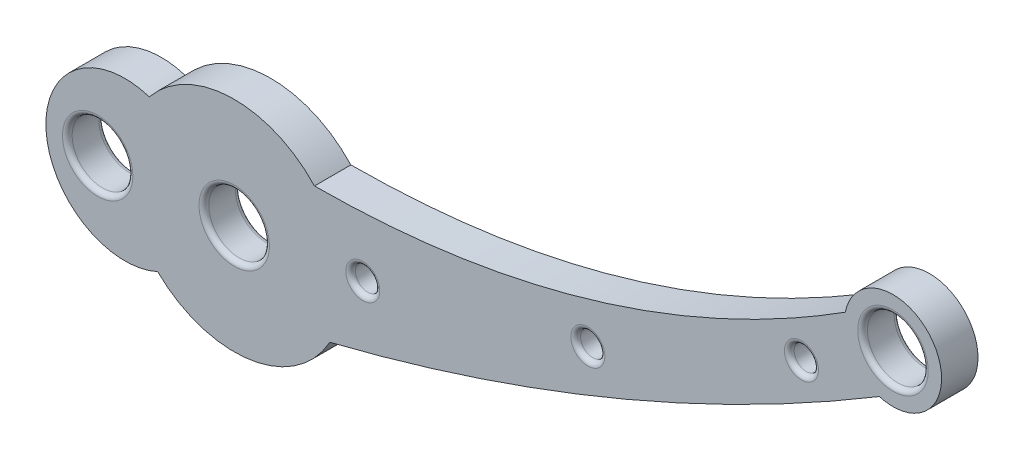
from build123d import *

# Parameters (mm, degrees)
SKETCH1_R               = 5
BOSS_EXTRUDE1_DEPTH     = 3
SHELL1_START            = -3
SHELL1_OUTLINE_R        = 9
SHELL1_DEPTH            = 2
BOSS_EXTRUDE2_START     = -2
SKETCH2_R               = 17.523356528
SKETCH2_R_2             = 14.0203
BOSS_EXTRUDE2_DEPTH     = 2
CUT_EXTRUDE1_START      = -3
SKETCH3_R               = 4.4
SKETCH3_R_2             = 2
CUT_EXTRUDE1_DEPTH      = 2
CUT_EXTRUDE2_DEPTH      = 125.685100358
CUT_EXTRUDE2_DEPTH_BACK = 125.685100358
FILLET1_R               = 0.8


# Read off the part's stored shape, not the designer's step: Shell1
with BuildPart() as part:
    # Sketch1 → Boss-Extrude1 (new, symmetric)
    with BuildSketch(Plane.XY):
        with BuildLine():
            ThreePointArc((-13.986661418, 11.362416753), (-30.99016616, -1.768742422), (-12.603041823, -12.88000578))
            ThreePointArc((-12.603041823, -12.88000578), (2.589578584, -17.833263718), (15.7458991, -8.7634396))
            add(Edge.make_bspline(
                [(15.7458991, -8.7634396), (63.871433409, 3.240310882), (106.224960773, 28.730122074)],
                knots=[0, 0, 0, 0.937425, 0.937425, 0.937425], degree=2))
            ThreePointArc((106.224960773, 28.730122074), (115.307763597, 40.561261508), (100.621270103, 37.95740354))
            add(Edge.make_bspline(
                [(100.621270103, 37.95740354), (60.4120667, 12.413572858), (13.212454281, 12.254071322)],
                knots=[1.049785924, 1.049785924, 1.049785924, 1.987896241, 1.987896241, 1.987896241], degree=2))
            ThreePointArc((13.212454281, 12.254071322), (-0.59043301, 18.010624669), (-13.986661418, 11.362416753))
        make_face()
        with Locations((-22.486761251, -1.283416434)):
            Circle(SKETCH1_R, mode=Mode.SUBTRACT)
        Circle(SKETCH1_R, mode=Mode.SUBTRACT)
        with Locations((108.469927907, 36.408671583)):
            Circle(SKETCH1_R, mode=Mode.SUBTRACT)
    extrude(amount=BOSS_EXTRUDE1_DEPTH, both=True)

    # Shell1 outline → Shell1 (cut)
    with BuildSketch(Plane.XY.offset(SHELL1_START)):
        with BuildLine():
            ThreePointArc((-11.793799998, -7.581232992), (1.267131363, -13.962921979), (12.965880978, -5.334298694))
            add(Edge.make_bspline(
                [(12.965880978, -5.334298694), (13.091467509, -5.302974172), (13.21705404, -5.271649649), (13.342640571, -5.240325127), (13.468227101, -5.209000604), (13.593813632, -5.177676082), (13.719400163, -5.14635156), (13.844986694, -5.115027037), (13.970573225, -5.083702515), (14.096159756, -5.052377992), (14.221746287, -5.02105347), (14.347332818, -4.989728947), (14.472919349, -4.958404425), (14.606355038, -4.92512212), (14.614204196, -4.923164337), (14.622053354, -4.921206554), (14.629902512, -4.919248772), (14.637751671, -4.917290989), (14.645600829, -4.915333206), (14.653449987, -4.913375424), (14.661299145, -4.911417641), (14.669148303, -4.909459858), (14.676997462, -4.907502076), (14.68484662, -4.905544293), (14.692695778, -4.90358651), (14.704469515, -4.900649836), (14.708394094, -4.899670945), (14.712318673, -4.898692054), (14.716243252, -4.897713162), (14.720167832, -4.896734271), (14.724092411, -4.89575538), (14.72801699, -4.894776488), (14.731941569, -4.893797597), (14.735866148, -4.892818706), (14.739790727, -4.891839814), (14.743715306, -4.890860923), (14.747639885, -4.889882032), (14.753526754, -4.888413695), (14.755489043, -4.887924249), (14.757451333, -4.887434803), (14.759413622, -4.886945358), (14.761375912, -4.886455912), (14.763338202, -4.885966466), (14.765300491, -4.885477021), (14.767262781, -4.884987575), (14.76922507, -4.884498129), (14.77118736, -4.884008684), (14.773149649, -4.883519238), (14.775111939, -4.883029792), (14.778055373, -4.882295624), (14.779063903, -4.882044071), (14.779844692, -4.881849326), (14.781264137, -4.881495242), (14.781497944, -4.881436973), (14.783358504, -4.880972806), (14.783510742, -4.880934899), (14.78504843, -4.880551277), (14.785724208, -4.88038273), (14.786802115, -4.880113832), (14.787745771, -4.879878432), (14.788718457, -4.879635785), (14.790657615, -4.879152034), (14.791627192, -4.878910155), (14.792596769, -4.878668274), (14.793566344, -4.87842639), (14.794535917, -4.878184502), (14.795505489, -4.877942612), (14.79647506, -4.877700719), (14.79744463, -4.877458822), (14.798414199, -4.877216923), (14.799383766, -4.87697502), (14.800353331, -4.876733115), (14.801322896, -4.876491207), (14.81780547, -4.872378714), (14.833318148, -4.868507365), (14.848830492, -4.86463525), (14.864342503, -4.860762367), (14.87985418, -4.856888718), (14.895365524, -4.853014302), (14.910876535, -4.849139118), (14.926387213, -4.845263168), (14.941897557, -4.841386451), (14.957407567, -4.837508966), (14.972917245, -4.833630715), (14.988426589, -4.829751697), (15.034953621, -4.818112341), (15.065970309, -4.810349703), (15.096985663, -4.802583997), (15.127999684, -4.794815223), (15.159012372, -4.787043382), (15.190023727, -4.779268472), (15.221033748, -4.771490494), (15.252042436, -4.763709449), (15.28304979, -4.755925336), (15.314055811, -4.748138155), (15.345060499, -4.740347906), (15.376063854, -4.732554589), (15.469069919, -4.709165435), (15.531068628, -4.693560394), (15.593062006, -4.677943082), (15.65505005, -4.662313499), (15.717032761, -4.646671644), (15.779010141, -4.631017517), (15.840982187, -4.61535112), (15.902948901, -4.599672451), (15.964910283, -4.58398151), (16.026866333, -4.568278298), (16.088817051, -4.552562815), (16.150762437, -4.536835061), (16.460462707, -4.458134932), (16.708137614, -4.394978487), (16.955727219, -4.331625702), (17.203231528, -4.268076576), (17.450650548, -4.20433111), (17.697984287, -4.140389305), (17.945232751, -4.07625116), (18.192395947, -4.011916676), (18.439473881, -3.947385854), (18.686466561, -3.882658694), (18.933373994, -3.817735196), (19.180196186, -3.75261536), (19.92040706, -3.556666841), (20.41354004, -3.42524915), (20.906332139, -3.293046113), (21.398783414, -3.160057731), (21.89089392, -3.026284004), (22.382663713, -2.891724933), (22.874092847, -2.756380518), (23.365181379, -2.62025076), (23.855929364, -2.483335658), (24.346336858, -2.345635214), (24.836403916, -2.207149428), (25.326130594, -2.0678783), (26.794289656, -1.647708893), (27.771701062, -1.364454628), (28.747751619, -1.078058999), (29.722441779, -0.788521966), (30.695771995, -0.49584349), (31.66774272, -0.200023534), (32.638354406, 0.098937942), (33.607607504, 0.401040976), (34.575502469, 0.706285607), (35.542039752, 1.014671875), (36.507219806, 1.326199816), (37.471043084, 1.640869471), (40.358443943, 2.594303692), (42.27795254, 3.242493717), (44.192039502, 3.903251495), (46.100708485, 4.57657766), (48.003963131, 5.262472933), (49.901807066, 5.960938126), (51.794243896, 6.671974141), (53.681277215, 7.395581971), (55.562910597, 8.131762697), (57.439147603, 8.880517491), (59.309991774, 9.641847614), (61.175446638, 10.415754419), (66.087097418, 12.492526394), (69.124183218, 13.816667273), (72.146788492, 15.174668269), (75.154928348, 16.566536317), (78.148617578, 17.992278966), (81.127870628, 19.451904349), (84.092701563, 20.945421144), (87.043124035, 22.472838546), (89.979151248, 24.034166231), (92.900795926, 25.629414321), (95.80807028, 27.258593353), (98.700985974, 28.921714246), (101.579554091, 30.618788264)],
                knots=[-0.017647481, -0.017647481, -0.017647481, -0.017647481, -0.017647481, -0.017647481, -0.017647481, -0.017647481, -0.017647481, -0.017647481, -0.017647481, -0.017647481, -0.017647481, -0.017647481, -0.001746739, -0.001746739, -0.001746739, -0.001746739, -0.001746739, -0.001746739, -0.001746739, -0.001746739, -0.001746739, -0.001746739, -0.001746739, -0.001746739, -0.000752943, -0.000752943, -0.000752943, -0.000752943, -0.000752943, -0.000752943, -0.000752943, -0.000752943, -0.000752943, -0.000752943, -0.000752943, -0.000752943, -0.000256045, -0.000256045, -0.000256045, -0.000256045, -0.000256045, -0.000256045, -0.000256045, -0.000256045, -0.000256045, -0.000256045, -0.000256045, -0.000256045, -7.596e-06, -7.596e-06, -7.596e-06, -7.596e-06, -7.596e-06, -7.596e-06, -7.596e-06, -7.596e-06, -7.596e-06, -7.596e-06, -7.596e-06, -7.596e-06, 0.000116629, 0.000116629, 0.000116629, 0.000116629, 0.000116629, 0.000116629, 0.000116629, 0.000116629, 0.000116629, 0.000116629, 0.000116629, 0.000116629, 0.000240853, 0.000240853, 0.000240853, 0.000240853, 0.000240853, 0.000240853, 0.000240853, 0.000240853, 0.000240853, 0.000240853, 0.000240853, 0.000240853, 0.002228446, 0.002228446, 0.002228446, 0.002228446, 0.002228446, 0.002228446, 0.002228446, 0.002228446, 0.002228446, 0.002228446, 0.002228446, 0.002228446, 0.006203632, 0.006203632, 0.006203632, 0.006203632, 0.006203632, 0.006203632, 0.006203632, 0.006203632, 0.006203632, 0.006203632, 0.006203632, 0.006203632, 0.014154002, 0.014154002, 0.014154002, 0.014154002, 0.014154002, 0.014154002, 0.014154002, 0.014154002, 0.014154002, 0.014154002, 0.014154002, 0.014154002, 0.045955486, 0.045955486, 0.045955486, 0.045955486, 0.045955486, 0.045955486, 0.045955486, 0.045955486, 0.045955486, 0.045955486, 0.045955486, 0.045955486, 0.109558454, 0.109558454, 0.109558454, 0.109558454, 0.109558454, 0.109558454, 0.109558454, 0.109558454, 0.109558454, 0.109558454, 0.109558454, 0.109558454, 0.236764389, 0.236764389, 0.236764389, 0.236764389, 0.236764389, 0.236764389, 0.236764389, 0.236764389, 0.236764389, 0.236764389, 0.236764389, 0.236764389, 0.491176259, 0.491176259, 0.491176259, 0.491176259, 0.491176259, 0.491176259, 0.491176259, 0.491176259, 0.491176259, 0.491176259, 0.491176259, 0.491176259, 0.908557864, 0.908557864, 0.908557864, 0.908557864, 0.908557864, 0.908557864, 0.908557864, 0.908557864, 0.908557864, 0.908557864, 0.908557864, 0.908557864, 0.908557864, 0.908557864], degree=13))
            ThreePointArc((101.579554091, 30.618788264), (100.779952373, 31.732746403), (100.158859236, 32.955247552))
            add(Edge.make_bspline(
                [(11.337726348, 8.247713219), (11.460941784, 8.248129601), (11.584157221, 8.248545982), (11.707372657, 8.248962364), (11.830588093, 8.249378745), (11.953803529, 8.249795127), (12.077018965, 8.250211509), (12.200234402, 8.25062789), (12.323449838, 8.251044272), (12.446665274, 8.251460654), (12.56988071, 8.251877035), (12.693096146, 8.252293417), (12.816311583, 8.252709798), (12.954928948, 8.253178228), (12.970330878, 8.253230275), (12.985732807, 8.253282323), (13.001134737, 8.253334371), (13.016536666, 8.253386418), (13.031938596, 8.253438466), (13.047340525, 8.253490514), (13.062742455, 8.253542562), (13.078144384, 8.253594609), (13.093546314, 8.253646657), (13.108948243, 8.253698705), (13.124350173, 8.253750752), (13.143602585, 8.253815812), (13.147453067, 8.253828824), (13.15130355, 8.253841836), (13.155154032, 8.253854848), (13.159004514, 8.25386786), (13.162854997, 8.253880872), (13.166705479, 8.253893884), (13.170555962, 8.253906896), (13.174406444, 8.253919907), (13.178256926, 8.253932919), (13.182107409, 8.253945931), (13.185957891, 8.253958943), (13.191733615, 8.253978461), (13.193658856, 8.253984967), (13.195584097, 8.253991473), (13.197509338, 8.253997979), (13.199434579, 8.254004485), (13.201359821, 8.254010991), (13.203285062, 8.254017497), (13.205210303, 8.254024003), (13.207135544, 8.254030509), (13.209060785, 8.254037015), (13.210986027, 8.254043521), (13.212911268, 8.254050027), (13.215317819, 8.254058159), (13.21579913, 8.254059786), (13.21628044, 8.254061412), (13.21676175, 8.254063039), (13.21724306, 8.254064665), (13.217724371, 8.254066292), (13.218205681, 8.254067918), (13.218686991, 8.254069545), (13.219168302, 8.254071171), (13.219649612, 8.254072798), (13.220130922, 8.254074424), (13.220612233, 8.254076051), (13.221334198, 8.25407849), (13.221574853, 8.254079304), (13.221815508, 8.254080117), (13.222056163, 8.25408093), (13.222296818, 8.254081743), (13.222537474, 8.254082557), (13.222778129, 8.25408337), (13.223018784, 8.254084183), (13.223259439, 8.254084996), (13.223500094, 8.25408581), (13.223740749, 8.254086623), (13.223981405, 8.254087436), (13.224462715, 8.254089063), (13.224709046, 8.254089895), (13.224901329, 8.254090544), (13.225345475, 8.254092049), (13.22504416, 8.254091022), (13.226271591, 8.25409518), (13.225264809, 8.254091773), (13.226575551, 8.254096198), (13.226216174, 8.254094991), (13.226691195, 8.254096593), (13.226883582, 8.254097246), (13.22713589, 8.2540981), (13.228366609, 8.254102268), (13.229351183, 8.254105609), (13.230335756, 8.254108956), (13.231320327, 8.254112308), (13.232304896, 8.254115666), (13.233289464, 8.254119031), (13.23427403, 8.2541224), (13.235258596, 8.254125777), (13.236243159, 8.254129158), (13.237227721, 8.254132546), (13.238212281, 8.254135939), (13.23919684, 8.254139338), (13.248057857, 8.254169984), (13.25593422, 8.2541976), (13.263810487, 8.25422559), (13.271686657, 8.254253954), (13.279562732, 8.254282692), (13.28743871, 8.254311805), (13.295314591, 8.254341292), (13.303190377, 8.254371154), (13.311066066, 8.25440139), (13.318941659, 8.254432001), (13.326817155, 8.254462986), (13.334692555, 8.254494345), (13.374069075, 8.254653014), (13.40556875, 8.254785939), (13.437066884, 8.254924856), (13.468563477, 8.255069762), (13.500058529, 8.25522066), (13.53155204, 8.255377547), (13.56304401, 8.255540426), (13.594534439, 8.255709296), (13.626023327, 8.255884156), (13.657510673, 8.256065007), (13.688996478, 8.256251849), (13.720480741, 8.256444682), (13.814928906, 8.257041154), (13.877888184, 8.257462766), (13.940841294, 8.257908342), (14.003788238, 8.258377883), (14.066729013, 8.258871389), (14.12966362, 8.25938886), (14.192592058, 8.259930297), (14.255514326, 8.2604957), (14.318430424, 8.261085069), (14.381340351, 8.261698406), (14.444244107, 8.262335709), (14.50714169, 8.26299698), (14.821598746, 8.266423173), (15.073065632, 8.269547615), (15.32443372, 8.273055565), (15.575702972, 8.276947046), (15.826873349, 8.281222077), (16.077944813, 8.285880681), (16.328917326, 8.29092288), (16.579790848, 8.296348694), (16.830565342, 8.302158146), (17.081240767, 8.308351256), (17.331817087, 8.314928046), (17.582294262, 8.321888537), (18.333428239, 8.343921181), (18.833787513, 8.360144526), (19.333749743, 8.377902934), (19.833314593, 8.397196554), (20.332481728, 8.418025531), (20.831250814, 8.440390015), (21.329621514, 8.464290153), (21.827593495, 8.489726092), (22.325166421, 8.516697979), (22.822339956, 8.545205963), (23.319113767, 8.575250191), (23.815487517, 8.606830811), (25.303407582, 8.706182286), (26.293752609, 8.778562617), (27.28249312, 8.857090017), (28.269626243, 8.941765472), (29.255149064, 9.032589901), (30.239058632, 9.129564155), (31.221351956, 9.232689017), (32.202026006, 9.341965202), (33.181077713, 9.457393357), (34.158503966, 9.578974062), (35.134301617, 9.706707827), (36.108467479, 9.840595096), (39.026060015, 10.260718541), (40.964581718, 10.56541625), (42.896537822, 10.894732355), (44.821902267, 11.248668567), (46.740648653, 11.627225329), (48.652750347, 12.030401815), (50.558180593, 12.458195936), (52.456912621, 12.910604345), (54.348919753, 13.387622437), (56.234175513, 13.889244353), (58.112653735, 14.415462984), (59.984328673, 14.966269973), (64.90848085, 16.485583806), (67.949409127, 17.495660221), (70.971848636, 18.571843503), (73.975691746, 19.714083217), (76.960835801, 20.922320885), (79.927184257, 22.196490944), (82.8746476, 23.536521713), (85.803144091, 24.942336373), (88.712600307, 26.413853977), (91.60295149, 27.950990459), (94.474141708, 29.553659674), (97.326123816, 31.221774448), (100.158859236, 32.955247552)],
                knots=[-0.018764796, -0.018764796, -0.018764796, -0.018764796, -0.018764796, -0.018764796, -0.018764796, -0.018764796, -0.018764796, -0.018764796, -0.018764796, -0.018764796, -0.018764796, -0.018764796, -0.002846596, -0.002846596, -0.002846596, -0.002846596, -0.002846596, -0.002846596, -0.002846596, -0.002846596, -0.002846596, -0.002846596, -0.002846596, -0.002846596, -0.000856821, -0.000856821, -0.000856821, -0.000856821, -0.000856821, -0.000856821, -0.000856821, -0.000856821, -0.000856821, -0.000856821, -0.000856821, -0.000856821, -0.000359377, -0.000359377, -0.000359377, -0.000359377, -0.000359377, -0.000359377, -0.000359377, -0.000359377, -0.000359377, -0.000359377, -0.000359377, -0.000359377, -0.000110655, -0.000110655, -0.000110655, -0.000110655, -0.000110655, -0.000110655, -0.000110655, -0.000110655, -0.000110655, -0.000110655, -0.000110655, -0.000110655, -4.8475e-05, -4.8475e-05, -4.8475e-05, -4.8475e-05, -4.8475e-05, -4.8475e-05, -4.8475e-05, -4.8475e-05, -4.8475e-05, -4.8475e-05, -4.8475e-05, -4.8475e-05, -1.7384e-05, -1.7384e-05, -1.7384e-05, -1.7384e-05, -1.7384e-05, -1.7384e-05, -1.7384e-05, -1.7384e-05, -1.7384e-05, -1.7384e-05, -1.7384e-05, -1.7384e-05, 1.3706e-05, 1.3706e-05, 1.3706e-05, 1.3706e-05, 1.3706e-05, 1.3706e-05, 1.3706e-05, 1.3706e-05, 1.3706e-05, 1.3706e-05, 1.3706e-05, 1.3706e-05, 0.000138067, 0.000138067, 0.000138067, 0.000138067, 0.000138067, 0.000138067, 0.000138067, 0.000138067, 0.000138067, 0.000138067, 0.000138067, 0.000138067, 0.001132954, 0.001132954, 0.001132954, 0.001132954, 0.001132954, 0.001132954, 0.001132954, 0.001132954, 0.001132954, 0.001132954, 0.001132954, 0.001132954, 0.005112504, 0.005112504, 0.005112504, 0.005112504, 0.005112504, 0.005112504, 0.005112504, 0.005112504, 0.005112504, 0.005112504, 0.005112504, 0.005112504, 0.013071604, 0.013071604, 0.013071604, 0.013071604, 0.013071604, 0.013071604, 0.013071604, 0.013071604, 0.013071604, 0.013071604, 0.013071604, 0.013071604, 0.044908004, 0.044908004, 0.044908004, 0.044908004, 0.044908004, 0.044908004, 0.044908004, 0.044908004, 0.044908004, 0.044908004, 0.044908004, 0.044908004, 0.108580804, 0.108580804, 0.108580804, 0.108580804, 0.108580804, 0.108580804, 0.108580804, 0.108580804, 0.108580804, 0.108580804, 0.108580804, 0.108580804, 0.235926403, 0.235926403, 0.235926403, 0.235926403, 0.235926403, 0.235926403, 0.235926403, 0.235926403, 0.235926403, 0.235926403, 0.235926403, 0.235926403, 0.490617602, 0.490617602, 0.490617602, 0.490617602, 0.490617602, 0.490617602, 0.490617602, 0.490617602, 0.490617602, 0.490617602, 0.490617602, 0.490617602, 0.908441951, 0.908441951, 0.908441951, 0.908441951, 0.908441951, 0.908441951, 0.908441951, 0.908441951, 0.908441951, 0.908441951, 0.908441951, 0.908441951, 0.908441951, 0.908441951], degree=13))
            ThreePointArc((11.337726348, 8.247713219), (-1.201705579, 13.968704872), (-12.579790903, 6.190127053))
            ThreePointArc((-12.579790903, 6.190127053), (-16.51195231, 7.871386314), (-20.776562793, 7.55260197))
            ThreePointArc((-20.776562793, 7.55260197), (-13.501384182, -0.770582217), (-19.78232402, -9.867472542))
            ThreePointArc((-19.78232402, -9.867472542), (-15.509136424, -9.698967933), (-11.793799998, -7.581232992))
        make_face()
        Circle(SHELL1_OUTLINE_R, mode=Mode.SUBTRACT)
    extrude(amount=SHELL1_DEPTH, mode=Mode.SUBTRACT)

    # Sketch2 → Boss-Extrude2 (add)
    with BuildSketch(Plane.XY.offset(-1).offset(BOSS_EXTRUDE2_START)):
        Circle(SKETCH2_R)
        Circle(SKETCH2_R_2, mode=Mode.SUBTRACT)
    extrude(amount=BOSS_EXTRUDE2_DEPTH)

    # Sketch3 → Cut-Extrude1 (cut)
    # profile 1 of 3: a face of its own
    with BuildSketch(Plane.XY.offset(CUT_EXTRUDE1_START)):
        with Locations((93.400085506, 27.483303488)):
            Circle(SKETCH3_R)
        with Locations((93.400085506, 27.483303488)):
            Circle(SKETCH3_R_2, mode=Mode.SUBTRACT)
    # profile 2 of 3: a face of its own
    with BuildSketch(Plane.XY.offset(CUT_EXTRUDE1_START)):
        with Locations((58.228171872, 11.880638788)):
            Circle(SKETCH3_R)
    # profile 3 of 3: a face of its own
    with BuildSketch(Plane.XY.offset(CUT_EXTRUDE1_START)):
        with Locations((21.16652838, 2.687087966)):
            Circle(SKETCH3_R)
    extrude(amount=CUT_EXTRUDE1_DEPTH, mode=Mode.SUBTRACT)

    # Sketch3<3> → Cut-Extrude2 (cut, two sides: drawn at the far end of the back side and taken through both)
    with BuildSketch(Plane.XY.offset(-CUT_EXTRUDE2_DEPTH_BACK)):
        with BuildLine():
            ThreePointArc((19.190011126, 2.381507296), (21.319769191, 0.692967294), (23.16652838, 2.687087966))
            ThreePointArc((23.16652838, 2.687087966), (23.159961153, 2.849031715), (23.140302602, 3.009911943))
            add(Edge.make_bspline(
                [(19.190011126, 2.381507296), (21.170999041, 2.678959307), (23.140302602, 3.009911943)],
                knots=[0.020133275, 0.020133275, 0.020133275, 0.064624746, 0.064624746, 0.064624746], degree=2))
        make_face()
        with BuildLine():
            add(Edge.make_bspline(
                [(19.190011126, 2.381507296), (21.170999041, 2.678959307), (23.140302602, 3.009911943)],
                knots=[0.020133275, 0.020133275, 0.020133275, 0.064624746, 0.064624746, 0.064624746], degree=2))
            ThreePointArc((23.140302602, 3.009911943), (20.852323063, 4.662252521), (19.190011126, 2.381507296))
        make_face()
        with BuildLine():
            add(Edge.make_bspline(
                [(56.333093629, 11.241359153), (58.23123625, 11.872010174), (60.117317487, 12.537242814)],
                knots=[0.449453257, 0.449453257, 0.449453257, 0.494656852, 0.494656852, 0.494656852], degree=2))
            ThreePointArc((56.333093629, 11.241359153), (58.552088153, 9.90704353), (60.228171872, 11.880638788))
            ThreePointArc((60.228171872, 11.880638788), (60.200263558, 12.21358681), (60.117317487, 12.537242814))
        make_face()
        with BuildLine():
            ThreePointArc((60.117317487, 12.537242814), (57.580223252, 13.772770545), (56.333093629, 11.241359153))
            add(Edge.make_bspline(
                [(56.333093629, 11.241359153), (58.23123625, 11.872010174), (60.117317487, 12.537242814)],
                knots=[0.449453257, 0.449453257, 0.449453257, 0.494656852, 0.494656852, 0.494656852], degree=2))
        make_face()
        with BuildLine():
            add(Edge.make_bspline(
                [(56.333093629, 11.241359153), (58.23123625, 11.872010174), (60.117317487, 12.537242814)],
                knots=[0.449453257, 0.449453257, 0.449453257, 0.494656852, 0.494656852, 0.494656852], degree=2))
            ThreePointArc((56.333093629, 11.241359153), (58.552088153, 9.90704353), (60.228171872, 11.880638788))
            ThreePointArc((60.228171872, 11.880638788), (60.200263558, 12.21358681), (60.117317487, 12.537242814))
        make_face()
        with BuildLine():
            ThreePointArc((60.117317487, 12.537242814), (57.580223252, 13.772770545), (56.333093629, 11.241359153))
            add(Edge.make_bspline(
                [(56.333093629, 11.241359153), (58.23123625, 11.872010174), (60.117317487, 12.537242814)],
                knots=[0.449453257, 0.449453257, 0.449453257, 0.494656852, 0.494656852, 0.494656852], degree=2))
        make_face()
        with BuildLine():
            add(Edge.make_bspline(
                [(91.644438316, 26.525335354), (93.401710921, 27.474180604), (95.147260157, 28.456638343)],
                knots=[0.883136194, 0.883136194, 0.883136194, 0.927701886, 0.927701886, 0.927701886], degree=2))
            ThreePointArc((91.644438316, 26.525335354), (93.89440606, 25.545354265), (95.400085506, 27.483303488))
            ThreePointArc((95.400085506, 27.483303488), (95.33584754, 27.986120899), (95.147260157, 28.456638343))
        make_face()
        with BuildLine():
            ThreePointArc((95.147260157, 28.456638343), (92.43442472, 29.234731261), (91.644438316, 26.525335354))
            add(Edge.make_bspline(
                [(91.644438316, 26.525335354), (93.401710921, 27.474180604), (95.147260157, 28.456638343)],
                knots=[0.883136194, 0.883136194, 0.883136194, 0.927701886, 0.927701886, 0.927701886], degree=2))
        make_face()
        with BuildLine():
            add(Edge.make_bspline(
                [(91.644438316, 26.525335354), (93.401710921, 27.474180604), (95.147260157, 28.456638343)],
                knots=[0.883136194, 0.883136194, 0.883136194, 0.927701886, 0.927701886, 0.927701886], degree=2))
            ThreePointArc((91.644438316, 26.525335354), (93.89440606, 25.545354265), (95.400085506, 27.483303488))
            ThreePointArc((95.400085506, 27.483303488), (95.33584754, 27.986120899), (95.147260157, 28.456638343))
        make_face()
        with BuildLine():
            ThreePointArc((95.147260157, 28.456638343), (92.43442472, 29.234731261), (91.644438316, 26.525335354))
            add(Edge.make_bspline(
                [(91.644438316, 26.525335354), (93.401710921, 27.474180604), (95.147260157, 28.456638343)],
                knots=[0.883136194, 0.883136194, 0.883136194, 0.927701886, 0.927701886, 0.927701886], degree=2))
        make_face()
        with BuildLine():
            ThreePointArc((19.190011126, 2.381507296), (21.319769191, 0.692967294), (23.16652838, 2.687087966))
            ThreePointArc((23.16652838, 2.687087966), (23.159961153, 2.849031715), (23.140302602, 3.009911943))
            add(Edge.make_bspline(
                [(19.190011126, 2.381507296), (21.170999041, 2.678959307), (23.140302602, 3.009911943)],
                knots=[0.020133275, 0.020133275, 0.020133275, 0.064624746, 0.064624746, 0.064624746], degree=2))
        make_face()
        with BuildLine():
            add(Edge.make_bspline(
                [(19.190011126, 2.381507296), (21.170999041, 2.678959307), (23.140302602, 3.009911943)],
                knots=[0.020133275, 0.020133275, 0.020133275, 0.064624746, 0.064624746, 0.064624746], degree=2))
            ThreePointArc((23.140302602, 3.009911943), (20.852323063, 4.662252521), (19.190011126, 2.381507296))
        make_face()
    extrude(amount=CUT_EXTRUDE2_DEPTH + CUT_EXTRUDE2_DEPTH_BACK, mode=Mode.SUBTRACT)

    # Fillet1
    # the kernel refuses this fillet: 0.8 mm, written as the material it takes off along each edge
    with BuildSketch(Plane(origin=(108.469927907, 36.408671583, -3), x_dir=(1, 0, 0), z_dir=(0, -1, 0))) as fillet1_piece_1:
        with BuildLine():
            CenterArc((5 + FILLET1_R, FILLET1_R), FILLET1_R, 180, 90)
            Line((5 + FILLET1_R, 0), (5 + FILLET1_R, -FILLET1_R * 0.02))
            Line((5 + FILLET1_R, -FILLET1_R * 0.02), (5 - FILLET1_R * 0.02, -FILLET1_R * 0.02))
            Line((5 - FILLET1_R * 0.02, -FILLET1_R * 0.02), (5 - FILLET1_R * 0.02, FILLET1_R))
            Line((5 - FILLET1_R * 0.02, FILLET1_R), (5, FILLET1_R))
        make_face()
    revolve(axis=Axis((108.469927907, 36.408671583, -3), (0, 0, 1)), mode=Mode.SUBTRACT)
    with BuildSketch(Plane(origin=(0, 0, -3), x_dir=(1, 0, 0), z_dir=(0, -1, 0))) as fillet1_piece_2:
        with BuildLine():
            CenterArc((5 + FILLET1_R, FILLET1_R), FILLET1_R, 180, 90)
            Line((5 + FILLET1_R, 0), (5 + FILLET1_R, -FILLET1_R * 0.02))
            Line((5 + FILLET1_R, -FILLET1_R * 0.02), (5 - FILLET1_R * 0.02, -FILLET1_R * 0.02))
            Line((5 - FILLET1_R * 0.02, -FILLET1_R * 0.02), (5 - FILLET1_R * 0.02, FILLET1_R))
            Line((5 - FILLET1_R * 0.02, FILLET1_R), (5, FILLET1_R))
        make_face()
    revolve(axis=Axis((0, 0, -3), (0, 0, 1)), mode=Mode.SUBTRACT)
    with BuildSketch(Plane(origin=(0, 0, 3), x_dir=(1, 0, 0), z_dir=(0, -1, 0))) as fillet1_piece_3:
        with BuildLine():
            CenterArc((5 + FILLET1_R, -FILLET1_R), FILLET1_R, 90, 90)
            Line((5, -FILLET1_R), (5 - FILLET1_R * 0.02, -FILLET1_R))
            Line((5 - FILLET1_R * 0.02, -FILLET1_R), (5 - FILLET1_R * 0.02, FILLET1_R * 0.02))
            Line((5 - FILLET1_R * 0.02, FILLET1_R * 0.02), (5 + FILLET1_R, FILLET1_R * 0.02))
            Line((5 + FILLET1_R, FILLET1_R * 0.02), (5 + FILLET1_R, 0))
        make_face()
    revolve(axis=Axis((0, 0, 3), (0, 0, 1)), mode=Mode.SUBTRACT)
    with BuildSketch(Plane(origin=(-22.486761251, -1.283416434, -3), x_dir=(1, 0, 0), z_dir=(0, -1, 0))) as fillet1_piece_4:
        with BuildLine():
            CenterArc((5 + FILLET1_R, FILLET1_R), FILLET1_R, 180, 90)
            Line((5 + FILLET1_R, 0), (5 + FILLET1_R, -FILLET1_R * 0.02))
            Line((5 + FILLET1_R, -FILLET1_R * 0.02), (5 - FILLET1_R * 0.02, -FILLET1_R * 0.02))
            Line((5 - FILLET1_R * 0.02, -FILLET1_R * 0.02), (5 - FILLET1_R * 0.02, FILLET1_R))
            Line((5 - FILLET1_R * 0.02, FILLET1_R), (5, FILLET1_R))
        make_face()
    revolve(axis=Axis((-22.486761251, -1.283416434, -3), (0, 0, 1)), revolution_arc=3.266561669, mode=Mode.SUBTRACT)
    with BuildSketch(Plane(origin=(93.400085506, 27.483303488, -1), x_dir=(0.8735873251622613, 0.4866674278353192, 0), z_dir=(0.4866674278353192, -0.8735873251622613, 0))) as fillet1_piece_5:
        with BuildLine():
            CenterArc((2 + FILLET1_R, FILLET1_R), FILLET1_R, 180, 90)
            Line((2 + FILLET1_R, 0), (2 + FILLET1_R, -FILLET1_R * 0.02))
            Line((2 + FILLET1_R, -FILLET1_R * 0.02), (2 - FILLET1_R * 0.02, -FILLET1_R * 0.02))
            Line((2 - FILLET1_R * 0.02, -FILLET1_R * 0.02), (2 - FILLET1_R * 0.02, FILLET1_R))
            Line((2 - FILLET1_R * 0.02, FILLET1_R), (2, FILLET1_R))
        make_face()
    revolve(axis=Axis((93.400085506, 27.483303488, -1), (0, 0, 1)), mode=Mode.SUBTRACT)
    with BuildSketch(Plane(origin=(21.16652838, 2.687087966, -1), x_dir=(0.9868871110435968, 0.16141198857589018, 0), z_dir=(0.16141198857589018, -0.9868871110435968, 0))) as fillet1_piece_6:
        with BuildLine():
            CenterArc((2 + FILLET1_R, FILLET1_R), FILLET1_R, 180, 90)
            Line((2, FILLET1_R), (2 - FILLET1_R * 0.02, FILLET1_R))
            Line((2 - FILLET1_R * 0.02, FILLET1_R), (2 - FILLET1_R * 0.02, -FILLET1_R * 0.02))
            Line((2 - FILLET1_R * 0.02, -FILLET1_R * 0.02), (2 + FILLET1_R, -FILLET1_R * 0.02))
            Line((2 + FILLET1_R, -FILLET1_R * 0.02), (2 + FILLET1_R, 0))
        make_face()
    revolve(axis=Axis((21.16652838, 2.687087966, -1), (0, 0, 1)), mode=Mode.SUBTRACT)
    with BuildSketch(Plane(origin=(21.16652838, 2.687087966, 3), x_dir=(0.9868871110435968, 0.1614119885758904, 0), z_dir=(-0.1614119885758904, 0.9868871110435968, 0))) as fillet1_piece_7:
        with BuildLine():
            CenterArc((2 + FILLET1_R, FILLET1_R), FILLET1_R, 180, 90)
            Line((2, FILLET1_R), (2 - FILLET1_R * 0.02, FILLET1_R))
            Line((2 - FILLET1_R * 0.02, FILLET1_R), (2 - FILLET1_R * 0.02, -FILLET1_R * 0.02))
            Line((2 - FILLET1_R * 0.02, -FILLET1_R * 0.02), (2 + FILLET1_R, -FILLET1_R * 0.02))
            Line((2 + FILLET1_R, -FILLET1_R * 0.02), (2 + FILLET1_R, 0))
        make_face()
    revolve(axis=Axis((21.16652838, 2.687087966, 3), (0, 0, -1)), mode=Mode.SUBTRACT)
    with BuildSketch(Plane(origin=(93.400085506, 27.483303488, 3), x_dir=(0.8735873251622592, 0.48666742783532296, 0), z_dir=(-0.48666742783532296, 0.8735873251622592, 0))) as fillet1_piece_8:
        with BuildLine():
            CenterArc((2 + FILLET1_R, FILLET1_R), FILLET1_R, 180, 90)
            Line((2, FILLET1_R), (2 - FILLET1_R * 0.02, FILLET1_R))
            Line((2 - FILLET1_R * 0.02, FILLET1_R), (2 - FILLET1_R * 0.02, -FILLET1_R * 0.02))
            Line((2 - FILLET1_R * 0.02, -FILLET1_R * 0.02), (2 + FILLET1_R, -FILLET1_R * 0.02))
            Line((2 + FILLET1_R, -FILLET1_R * 0.02), (2 + FILLET1_R, 0))
        make_face()
    revolve(axis=Axis((93.400085506, 27.483303488, 3), (0, 0, -1)), mode=Mode.SUBTRACT)
    with BuildSketch(Plane(origin=(58.228171872, 11.880638788, -1), x_dir=(0.9445728073214131, 0.32830201289200855, 0), z_dir=(0.32830201289200855, -0.9445728073214131, 0))) as fillet1_piece_9:
        with BuildLine():
            CenterArc((2 + FILLET1_R, FILLET1_R), FILLET1_R, 180, 90)
            Line((2, FILLET1_R), (2 - FILLET1_R * 0.02, FILLET1_R))
            Line((2 - FILLET1_R * 0.02, FILLET1_R), (2 - FILLET1_R * 0.02, -FILLET1_R * 0.02))
            Line((2 - FILLET1_R * 0.02, -FILLET1_R * 0.02), (2 + FILLET1_R, -FILLET1_R * 0.02))
            Line((2 + FILLET1_R, -FILLET1_R * 0.02), (2 + FILLET1_R, 0))
        make_face()
    revolve(axis=Axis((58.228171872, 11.880638788, -1), (0, 0, 1)), mode=Mode.SUBTRACT)
    with BuildSketch(Plane(origin=(58.228171872, 11.880638788, 3), x_dir=(0.9445728073214139, 0.32830201289200617, 0), z_dir=(-0.32830201289200617, 0.9445728073214139, 0))) as fillet1_piece_10:
        with BuildLine():
            CenterArc((2 + FILLET1_R, FILLET1_R), FILLET1_R, 180, 90)
            Line((2, FILLET1_R), (2 - FILLET1_R * 0.02, FILLET1_R))
            Line((2 - FILLET1_R * 0.02, FILLET1_R), (2 - FILLET1_R * 0.02, -FILLET1_R * 0.02))
            Line((2 - FILLET1_R * 0.02, -FILLET1_R * 0.02), (2 + FILLET1_R, -FILLET1_R * 0.02))
            Line((2 + FILLET1_R, -FILLET1_R * 0.02), (2 + FILLET1_R, 0))
        make_face()
    revolve(axis=Axis((58.228171872, 11.880638788, 3), (0, 0, -1)), mode=Mode.SUBTRACT)
    with BuildSketch(Plane(origin=(108.469927907, 36.408671583, 3), x_dir=(1, 0, 0), z_dir=(0, -1, 0))) as fillet1_piece_11:
        with BuildLine():
            CenterArc((5 + FILLET1_R, -FILLET1_R), FILLET1_R, 90, 90)
            Line((5, -FILLET1_R), (5 - FILLET1_R * 0.02, -FILLET1_R))
            Line((5 - FILLET1_R * 0.02, -FILLET1_R), (5 - FILLET1_R * 0.02, FILLET1_R * 0.02))
            Line((5 - FILLET1_R * 0.02, FILLET1_R * 0.02), (5 + FILLET1_R, FILLET1_R * 0.02))
            Line((5 + FILLET1_R, FILLET1_R * 0.02), (5 + FILLET1_R, 0))
        make_face()
    revolve(axis=Axis((108.469927907, 36.408671583, 3), (0, 0, 1)), mode=Mode.SUBTRACT)
    with BuildSketch(Plane(origin=(-22.486761251, -1.283416434, 3), x_dir=(1, 0, 0), z_dir=(0, -1, 0))) as fillet1_piece_12:
        with BuildLine():
            CenterArc((5 + FILLET1_R, -FILLET1_R), FILLET1_R, 90, 90)
            Line((5, -FILLET1_R), (5 - FILLET1_R * 0.02, -FILLET1_R))
            Line((5 - FILLET1_R * 0.02, -FILLET1_R), (5 - FILLET1_R * 0.02, FILLET1_R * 0.02))
            Line((5 - FILLET1_R * 0.02, FILLET1_R * 0.02), (5 + FILLET1_R, FILLET1_R * 0.02))
            Line((5 + FILLET1_R, FILLET1_R * 0.02), (5 + FILLET1_R, 0))
        make_face()
    revolve(axis=Axis((-22.486761251, -1.283416434, 3), (0, 0, 1)), mode=Mode.SUBTRACT)
    with BuildSketch(Plane(origin=(-22.486761251, -1.283416434, -3), x_dir=(0.9983752414772695, 0.05698137595042403, 0), z_dir=(0.05698137595042403, -0.9983752414772695, 0))) as fillet1_piece_13:
        with BuildLine():
            CenterArc((5 + FILLET1_R, FILLET1_R), FILLET1_R, 180, 90)
            Line((5 + FILLET1_R, 0), (5 + FILLET1_R, -FILLET1_R * 0.02))
            Line((5 + FILLET1_R, -FILLET1_R * 0.02), (5 - FILLET1_R * 0.02, -FILLET1_R * 0.02))
            Line((5 - FILLET1_R * 0.02, -FILLET1_R * 0.02), (5 - FILLET1_R * 0.02, FILLET1_R))
            Line((5 - FILLET1_R * 0.02, FILLET1_R), (5, FILLET1_R))
        make_face()
    revolve(axis=Axis((-22.486761251, -1.283416434, -3), (0, 0, 1)), revolution_arc=356.733438331, mode=Mode.SUBTRACT)


solid = part.part
